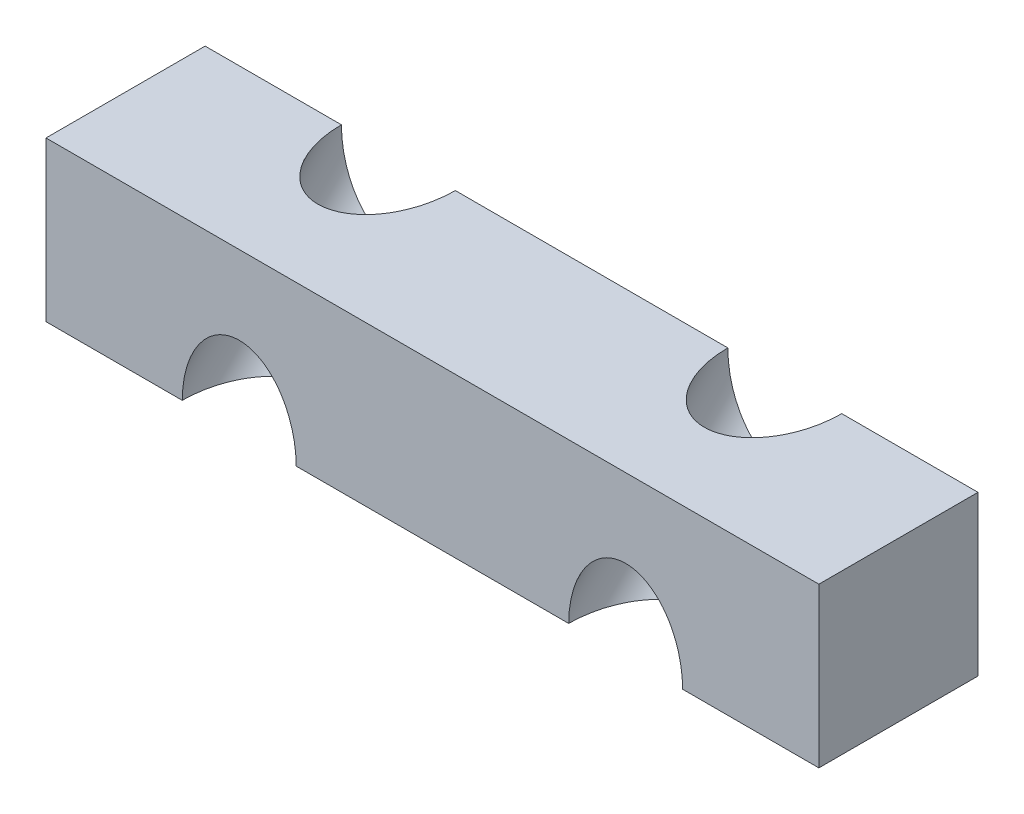
from build123d import *

# Parameters (mm, degrees)
SKETCH1_W               = 34
SKETCH1_H               = 7
BOSS_EXTRUDE1_DEPTH     = 7
CUT_EXTRUDE2_DEPTH      = 36.411862419
CUT_EXTRUDE2_DEPTH_BACK = 36.411862419
SKETCH6_OUTSIDE_W       = 43.082
SKETCH6_OUTSIDE_H       = 18.981
SKETCH6_OUTSIDE_W_2     = 34
SKETCH6_OUTSIDE_H_2     = 9.899494937
SKETCH6_OUTSIDE_R       = 2.505


with BuildPart() as part:
    # sketch1 → Boss-Extrude1 (new body)
    with BuildSketch(Plane(origin=(0, 0, 0), x_dir=(1, 0, 0), z_dir=(0, 1, 0))):
        with Locations((17, -3.5)):
            Rectangle(SKETCH1_W, SKETCH1_H)
    extrude(amount=BOSS_EXTRUDE1_DEPTH)

    # Sketch6 outside → Cut-Extrude2 (cut, two sides: drawn at the far end of the back side and taken through both)
    # profile 1 of 3: a face of its own
    with BuildSketch(Plane(origin=(0, 0, 0), x_dir=(-1, 0, 0), z_dir=(0, 0.7071067811865475, -0.7071067811865477)).offset(-CUT_EXTRUDE2_DEPTH_BACK)):
        with Locations((-17, 4.9495)):
            Rectangle(SKETCH6_OUTSIDE_W, SKETCH6_OUTSIDE_H)
        with Locations((-17, 4.949747469)):
            Rectangle(SKETCH6_OUTSIDE_W_2, SKETCH6_OUTSIDE_H_2, mode=Mode.SUBTRACT)
    # profile 2 of 3: a face of its own
    with BuildSketch(Plane(origin=(0, 0, 0), x_dir=(-1, 0, 0), z_dir=(0, 0.7071067811865475, -0.7071067811865477)).offset(-CUT_EXTRUDE2_DEPTH_BACK)):
        with Locations((-25.5, 4.949747468)):
            Circle(SKETCH6_OUTSIDE_R)
    # profile 3 of 3: a face of its own
    with BuildSketch(Plane(origin=(0, 0, 0), x_dir=(-1, 0, 0), z_dir=(0, 0.7071067811865475, -0.7071067811865477)).offset(-CUT_EXTRUDE2_DEPTH_BACK)):
        with Locations((-8.5, 4.949747468)):
            Circle(SKETCH6_OUTSIDE_R)
    extrude(amount=CUT_EXTRUDE2_DEPTH + CUT_EXTRUDE2_DEPTH_BACK, mode=Mode.SUBTRACT)


solid = part.part
